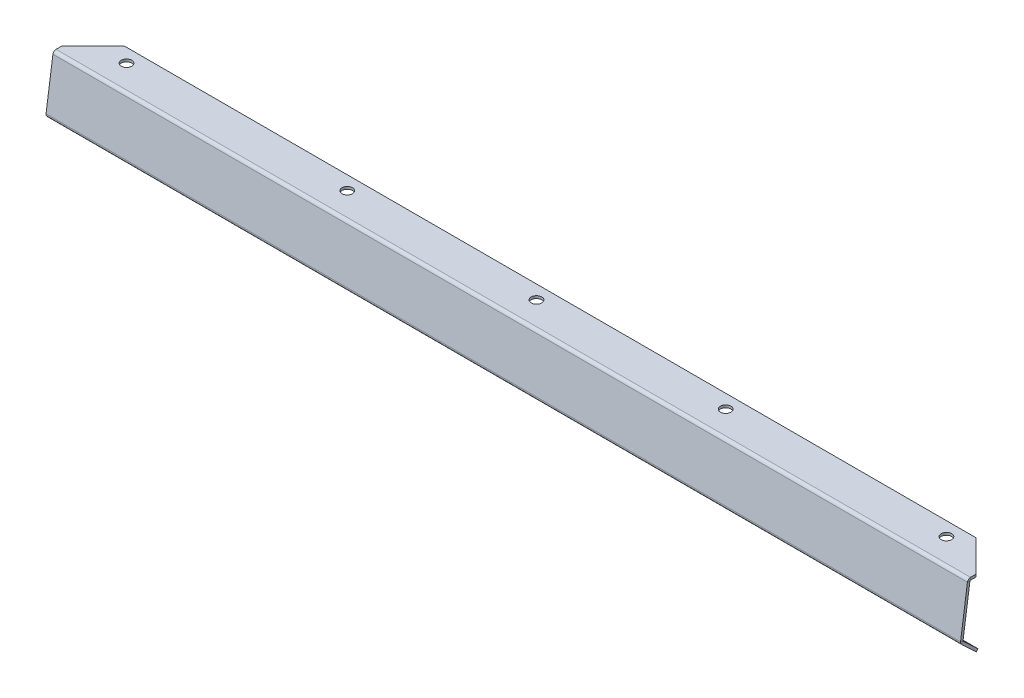
from build123d import *

# Parameters (mm, degrees)
BASE_FLANGE1_START = -184.15
BASE_FLANGE1_DEPTH = 368.3
SKETCH3_R          = 2.1082
CUT_EXTRUDE1_DEPTH = 187.620719687
CUT_EXTRUDE2_DEPTH = 1.016


# Read off the part's stored shape, not the designer's step: Base-Flange1
with BuildPart() as part:
    # Base-Flange1 outline → Base-Flange1 (new body)
    with BuildSketch(Plane(origin=(0, 0, 0), x_dir=(0, 0, -1), z_dir=(1, 0, 0)).offset(BASE_FLANGE1_START)):
        with BuildLine():
            ThreePointArc((-13.368341316, -20.466361674), (-13.309368584, -21.067196652), (-12.979624415, -21.57291321))
            Line((-12.979624415, -21.57291321), (-7.03115395, -27.148026465))
            Line((-7.03115395, -27.148026465), (-6.336374421, -26.406718563))
            Line((-6.336374421, -26.406718563), (-12.284844886, -20.831605308))
            ThreePointArc((-12.284844886, -20.831605308), (-12.350793719, -20.730461996), (-12.362588266, -20.610295001))
            Line((-12.362588266, -20.610295001), (-9.589648917, -1.234016668))
            ThreePointArc((-9.589648917, -1.234016668), (-9.504608121, -1.078094077), (-9.338210654, -1.016))
            Line((-9.338210654, -1.016), (5.562599869, -1.016))
            Line((5.562599869, -1.016), (5.562599869, 0))
            Line((5.562599869, 0), (-9.338210654, 0))
            ThreePointArc((-9.338210654, 0), (-10.170197987, -0.310470387), (-10.595401966, -1.090083341))
            Line((-10.595401966, -1.090083341), (-13.368341316, -20.466361674))
        make_face()
    extrude(amount=BASE_FLANGE1_DEPTH)

    # Sketch3 → Cut-Extrude1 (cut, through all)
    with BuildSketch(Plane(origin=(0, 0, 0), x_dir=(1, 0, 0), z_dir=(0, 1, 0))):
        with Locations(Location((0, 0, 0), (0, 0, 270))):
            Circle(SKETCH3_R)
        with Locations(Location((76.2, 0, 0), (0, 0, 270))):
            Circle(SKETCH3_R)
        with Locations(Location((165.1, 0, 0), (0, 0, 270))):
            Circle(SKETCH3_R)
        with Locations(Location((-165.1, 0, 0), (0, 0, 270))):
            Circle(SKETCH3_R)
        with Locations(Location((-76.2, 0, 0), (0, 0, 270))):
            Circle(SKETCH3_R)
    extrude(amount=-CUT_EXTRUDE1_DEPTH, mode=Mode.SUBTRACT)

    # Sketch4 → Cut-Extrude2 (cut)
    with BuildSketch(Plane(origin=(0, 0, 0), x_dir=(1, 0, 0), z_dir=(0, 1, 0))):
        Polygon((-170.559937336, 6.452662534), (-235.374711333, -58.362111464), (-235.374711333, 6.452662534), align=None)
        Polygon((235.374711333, 6.452662534), (170.559937336, 6.452662534), (235.374711333, -58.362111464), align=None)
    extrude(amount=-CUT_EXTRUDE2_DEPTH, mode=Mode.SUBTRACT)


solid = part.part
